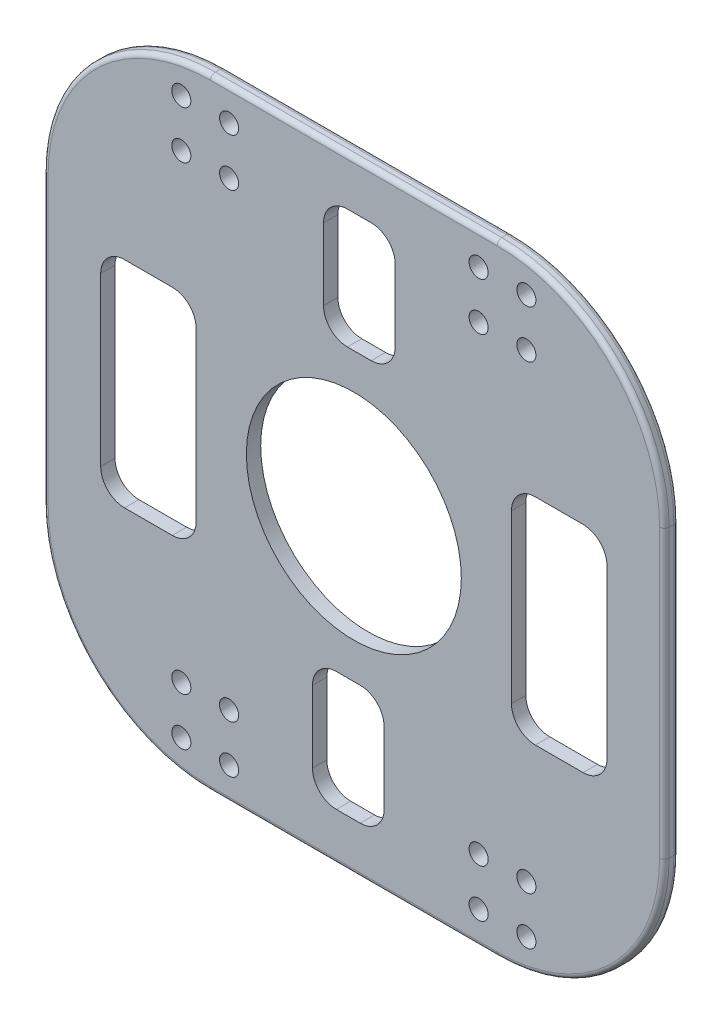
from build123d import *

# Parameters (mm, degrees)
SKETCH_1_W          = 130
SKETCH_1_H          = 130
SKETCH_1_R          = 22.5
EXTRUDE_1_DEPTH     = 3
FILLET_1_R          = 35
SKETCH_5_R          = 2
SKETCH_5_W          = 15
SKETCH_5_H          = 25
SKETCH_5_W_2        = 20
SKETCH_5_H_2        = 45
CUT_EXTRUDE_2_DEPTH = 13
FILLET_2_R          = 5
FILLET_3_R          = 1


with BuildPart() as part:
    # 草图1 → 凸台-拉伸1 (new body)
    with BuildSketch(Plane.XY):
        Rectangle(SKETCH_1_W, SKETCH_1_H)
        Circle(SKETCH_1_R, mode=Mode.SUBTRACT)
    extrude(amount=-EXTRUDE_1_DEPTH)

    # 圆角1
    fillet_1_edges = [part.edges().sort_by_distance(p)[0] for p in [
        (65, 65, -1.5),
        (-65, 65, -1.5),
        (65, -65, -1.5),
        (-65, -65, -1.5),
    ]]
    fillet(fillet_1_edges, radius=FILLET_1_R)

    # 草图5 → 切除-拉伸2 (cut)
    with BuildSketch(Plane(origin=(0, 0, -3), x_dir=(-1, 0, 0), z_dir=(0, 0, -1))):
        with Locations((36.119111303, 58.196758832)):
            Circle(SKETCH_5_R)
        with Locations((36.119111303, 48.196758832)):
            Circle(SKETCH_5_R)
        with Locations((-36.119111303, -58.196758832)):
            Circle(SKETCH_5_R)
        with Locations((26.119111303, 58.196758832)):
            Circle(SKETCH_5_R)
        with Locations((26.119111303, 48.196758832)):
            Circle(SKETCH_5_R)
        with Locations((26.119111303, -58.196758832)):
            Circle(SKETCH_5_R)
        with Locations((36.119111303, -48.196758832)):
            Circle(SKETCH_5_R)
        with Locations((36.119111303, -58.196758832)):
            Circle(SKETCH_5_R)
        with Locations((-36.119111303, -48.196758832)):
            Circle(SKETCH_5_R)
        with Locations((-26.119111303, -58.196758832)):
            Circle(SKETCH_5_R)
        with Locations((26.119111303, -48.196758832)):
            Circle(SKETCH_5_R)
        with Locations((-26.119111303, -48.196758832)):
            Circle(SKETCH_5_R)
        with Locations((-36.119111303, 48.196758832)):
            Circle(SKETCH_5_R)
        with Locations((-36.119111303, 58.196758832)):
            Circle(SKETCH_5_R)
        with Locations((-26.119111303, 58.196758832)):
            Circle(SKETCH_5_R)
        with Locations((-26.119111303, 48.196758832)):
            Circle(SKETCH_5_R)
        with Locations((-1.155156202, 42.5)):
            Rectangle(SKETCH_5_W, SKETCH_5_H)
        with Locations((-43, 0)):
            Rectangle(SKETCH_5_W_2, SKETCH_5_H_2)
        with Locations((1.155156202, -42.5)):
            Rectangle(SKETCH_5_W, SKETCH_5_H)
        with Locations((43, 0)):
            Rectangle(SKETCH_5_W_2, SKETCH_5_H_2)
    extrude(amount=-CUT_EXTRUDE_2_DEPTH, mode=Mode.SUBTRACT)

    # 圆角2
    fillet_2_edges = [part.edges().sort_by_distance(p)[0] for p in [
        (53, 22.5, -1.5),
        (33, 22.5, -1.5),
        (33, -22.5, -1.5),
        (53, -22.5, -1.5),
        (-6.344843798, 55, -1.5),
        (-53, 22.5, -1.5),
        (-53, -22.5, -1.5),
        (-33, -22.5, -1.5),
        (-33, 22.5, -1.5),
        (-8.655156202, -30, -1.5),
        (-8.655156202, -55, -1.5),
        (6.344843798, -55, -1.5),
        (6.344843798, -30, -1.5),
        (-6.344843798, 30, -1.5),
        (8.655156202, 55, -1.5),
        (8.655156202, 30, -1.5),
    ]]
    fillet(fillet_2_edges, radius=FILLET_2_R)

    # 圆角3
    fillet_3_edges = [part.edges().sort_by_distance(p)[0] for p in [
        (0, 65, 0),
        (54.748737342, 54.748737342, 0),
        (65, 0, 0),
        (54.748737342, -54.748737342, 0),
        (0, -65, 0),
        (-54.748737342, -54.748737342, 0),
        (-65, 0, 0),
        (-65, 0, -3),
        (-54.748737342, -54.748737342, -3),
        (0, -65, -3),
        (54.748737342, -54.748737342, -3),
        (65, 0, -3),
        (54.748737342, 54.748737342, -3),
        (0, 65, -3),
        (-54.748737342, 54.748737342, 0),
        (-54.748737342, 54.748737342, -3),
    ]]
    fillet(fillet_3_edges, radius=FILLET_3_R)


solid = part.part
